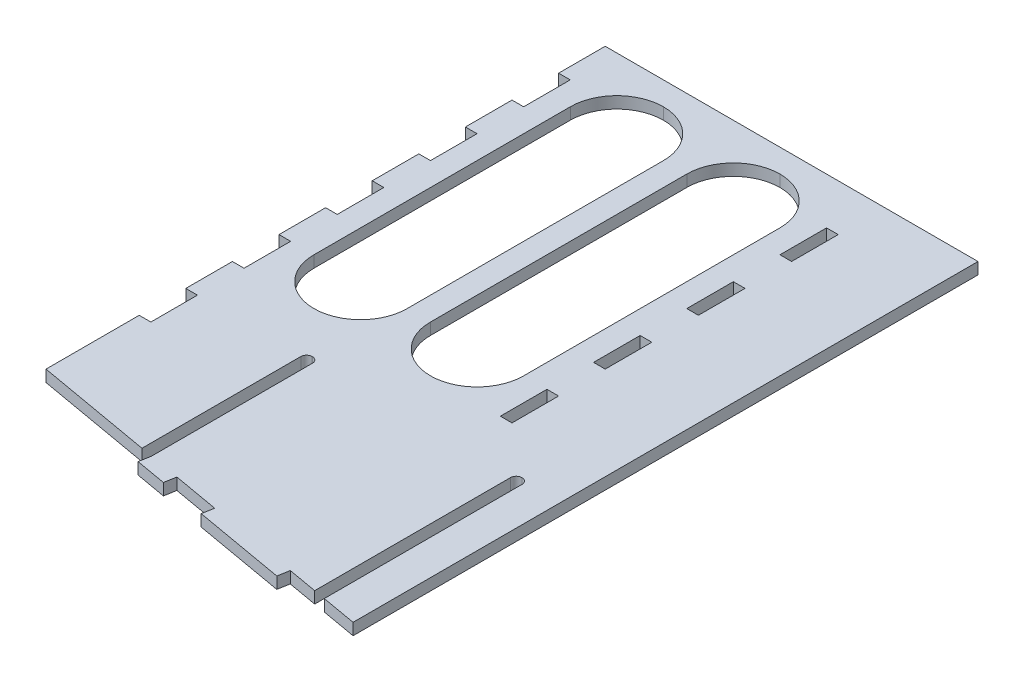
from build123d import *

# Parameters (mm, degrees)
SKETCH1_W           = 101.6
SKETCH1_H           = 152.4
BOSS_EXTRUDE1_DEPTH = 3.175
SKETCH2_W           = 3.175
SKETCH2_H           = 12.7
CUT_EXTRUDE1_DEPTH  = 3.175
LPATTERN1_COUNT     = 5
LPATTERN1_PITCH     = 25.4
SKETCH3_W           = 3.175
SKETCH3_H           = 12.7
CUT_EXTRUDE2_DEPTH  = 3.175
LPATTERN2_COUNT     = 4
LPATTERN2_PITCH     = 25.4
SKETCH5_W           = 3.175
SKETCH5_H           = 57.15
CUT_EXTRUDE3_DEPTH  = 3.175
FILLET1_R           = 1.524
BOSS_EXTRUDE2_DEPTH = 3.175
SKETCH7_W           = 25.4
SKETCH7_H           = 95.25
CUT_EXTRUDE4_DEPTH  = 3.175
FILLET2_R           = 12.7


with BuildPart() as part:
    # Sketch1 → Boss-Extrude1 (new body)
    with BuildSketch(Plane(origin=(0, 0, 0), x_dir=(1, 0, 0), z_dir=(0, 1, 0))):
        with Locations((50.8, 76.2)):
            Rectangle(SKETCH1_W, SKETCH1_H)
        Polygon((0, 0), (101.6, -17.91482124), (101.6, 0), align=None)
    extrude(amount=BOSS_EXTRUDE1_DEPTH)

    # Sketch2 → Cut-Extrude1 (cut)
    with BuildSketch(Plane(origin=(0, 3.175, 0), x_dir=(1, 0, 0), z_dir=(0, 1, 0))):
        with Locations((1.5875, 133.35)):
            Rectangle(SKETCH2_W, SKETCH2_H)
    cut_extrude1 = extrude(amount=-CUT_EXTRUDE1_DEPTH, mode=Mode.SUBTRACT)

    # LPattern1: Cut-Extrude1 ×5
    with Locations(*[(0, 0, i * LPATTERN1_PITCH) for i in range(1, LPATTERN1_COUNT)]):
        add(cut_extrude1, mode=Mode.SUBTRACT)

    # Sketch3 → Cut-Extrude2 (cut)
    with BuildSketch(Plane(origin=(0, 3.175, 0), x_dir=(1, 0, 0), z_dir=(0, 1, 0))):
        with Locations((74.6125, 133.35)):
            Rectangle(SKETCH3_W, SKETCH3_H)
    cut_extrude2 = extrude(amount=-CUT_EXTRUDE2_DEPTH, mode=Mode.SUBTRACT)

    # LPattern2: Cut-Extrude2 ×4
    with Locations(*[(0, 0, i * LPATTERN2_PITCH) for i in range(1, LPATTERN2_COUNT)]):
        add(cut_extrude2, mode=Mode.SUBTRACT)

    # Sketch5 → Cut-Extrude3 (cut)
    with BuildSketch(Plane(origin=(0, 3.175, 0), x_dir=(1, 0, 0), z_dir=(0, 1, 0))):
        with Locations((33.3375, 10.66017876)):
            Rectangle(SKETCH5_W, SKETCH5_H)
        with Locations((90.4875, 10.66017876)):
            Rectangle(SKETCH5_W, SKETCH5_H)
    extrude(amount=-CUT_EXTRUDE3_DEPTH, mode=Mode.SUBTRACT)

    # Fillet1
    fillet1_edges = [part.edges().sort_by_distance(p)[0] for p in [
        (34.925, 1.5875, -39.23517876),
        (31.75, 1.5875, -39.23517876),
        (92.075, 1.5875, -39.23517876),
        (88.9, 1.5875, -39.23517876),
    ]]
    fillet(fillet1_edges, radius=FILLET1_R)

    # Sketch6 → Boss-Extrude2 (add)
    with BuildSketch(Plane(origin=(0, 3.175, 0), x_dir=(1, 0, 0), z_dir=(0, 1, 0))):
        Polygon((34.925, -6.158219801), (43.30472917, -7.635792145), (42.753396206, -10.762556761), (34.373667036, -9.284984417), align=None)
        Polygon((55.811787634, -9.841124001), (80.82590456, -14.251787714), (80.274571596, -17.37855233), (55.26045467, -12.967888617), align=None)
    extrude(amount=-BOSS_EXTRUDE2_DEPTH)

    # Sketch7 → Cut-Extrude4 (cut)
    with BuildSketch(Plane(origin=(0, 3.175, 0), x_dir=(1, 0, 0), z_dir=(0, 1, 0))):
        with Locations((22.225, 98.425)):
            Rectangle(SKETCH7_W, SKETCH7_H)
        with Locations((53.975, 98.425)):
            Rectangle(SKETCH7_W, SKETCH7_H)
    extrude(amount=-CUT_EXTRUDE4_DEPTH, mode=Mode.SUBTRACT)

    # Fillet2
    fillet2_edges = [part.edges().sort_by_distance(p)[0] for p in [
        (66.675, 1.5875, -146.05),
        (34.925, 1.5875, -146.05),
        (41.275, 1.5875, -146.05),
        (9.525, 1.5875, -146.05),
        (34.925, 1.5875, -50.8),
        (41.275, 1.5875, -50.8),
        (66.675, 1.5875, -50.8),
        (9.525, 1.5875, -50.8),
    ]]
    fillet(fillet2_edges, radius=FILLET2_R - 0.0001)  # a hair under: the kernel refuses the full size


solid = part.part
